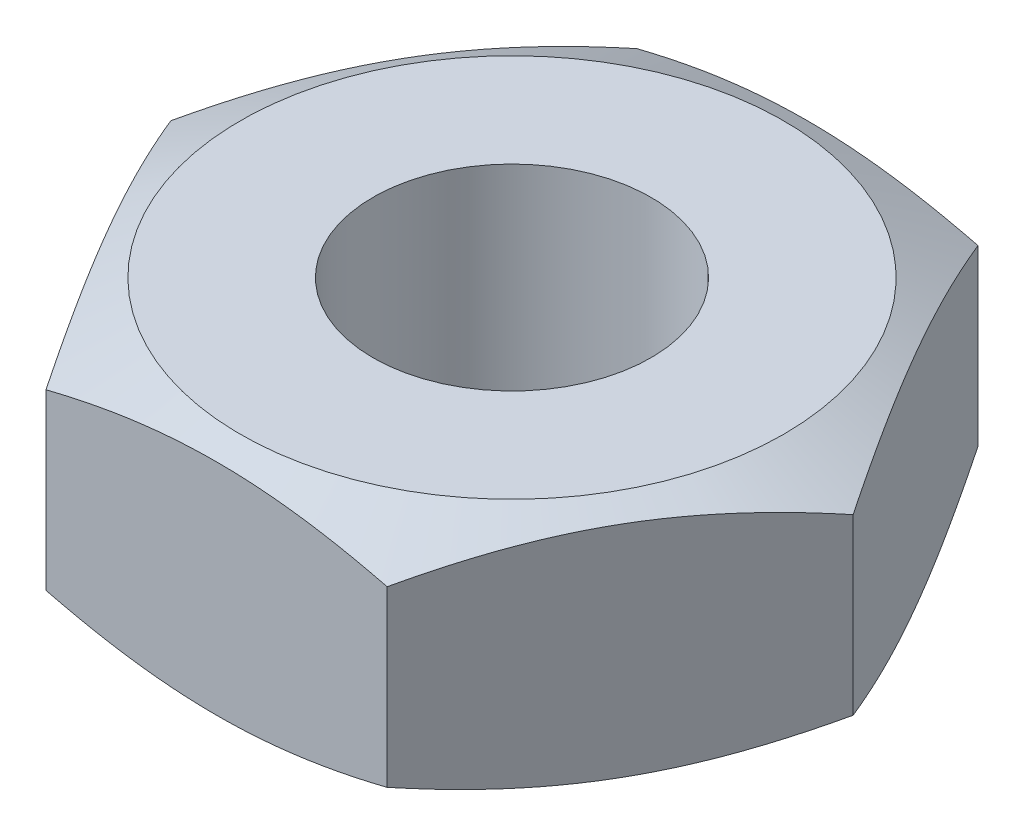
from build123d import *

# Parameters (mm, degrees)
SKETCH1_R           = 2
BOSS_EXTRUDE1_DEPTH = 3.5


with BuildPart() as part:
    # Sketch1 → Boss-Extrude1 (new body)
    with BuildSketch(Plane(origin=(0, 0, 0), x_dir=(1, 0, 0), z_dir=(0, 1, 0))):
        Polygon((2.453738644, 4.25), (-2.453738644, 4.25), (-4.907477288, 0), (-2.453738644, -4.25), (2.453738644, -4.25), (4.907477288, 0), align=None)
        Circle(SKETCH1_R, mode=Mode.SUBTRACT)
    extrude(amount=BOSS_EXTRUDE1_DEPTH)

    # Sketch2 → Cut-Revolve1 (revolve, cut)
    with BuildSketch(Plane.XY):
        Polygon((3.907477288, 3.5), (4.907477288, 3), (4.907477288, 3.5), align=None)
        Polygon((3.907477288, 0), (4.907477288, 0), (4.907477288, 0.5), align=None)
    revolve(axis=Axis((0, -1000, 0), (0, 1, 0)), mode=Mode.SUBTRACT)


solid = part.part
